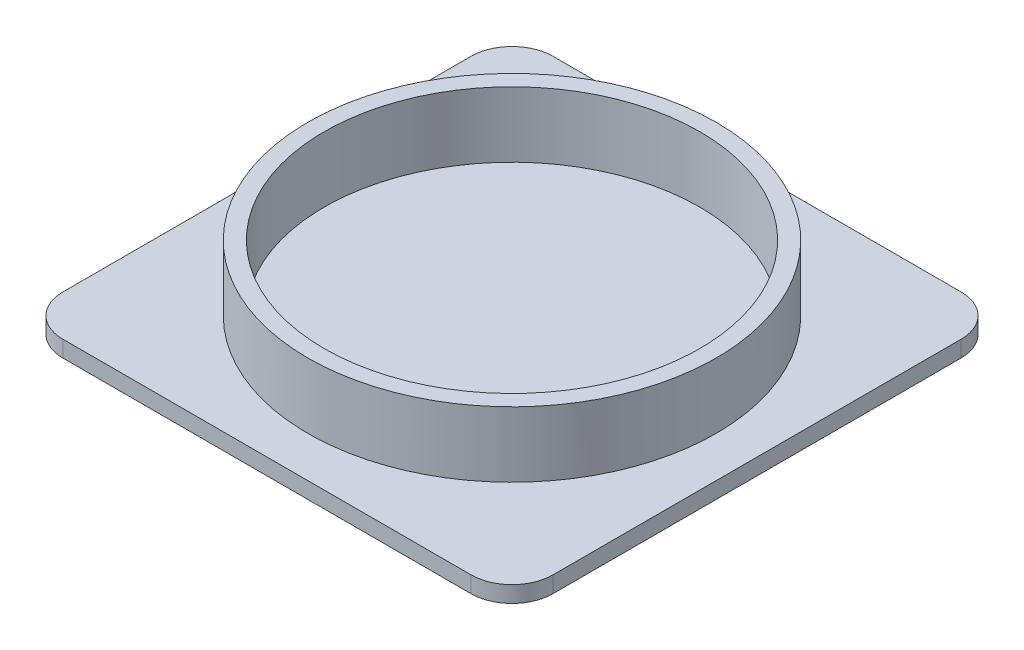
from build123d import *

# Parameters (mm, degrees)
SKETCH1_R           = 31.75
SKETCH1_R_2         = 29.21
BOSS_EXTRUDE1_DEPTH = 12.7
SKETCH2_W           = 76.2
SKETCH2_H           = 76.2
BOSS_EXTRUDE2_DEPTH = 2.54
FILLET1_R           = 6.35


with BuildPart() as part:
    # Sketch1 → Boss-Extrude1 (new body)
    with BuildSketch(Plane(origin=(0, 0, 0), x_dir=(1, 0, 0), z_dir=(0, 1, 0))):
        Circle(SKETCH1_R)
        Circle(SKETCH1_R_2, mode=Mode.SUBTRACT)
    extrude(amount=BOSS_EXTRUDE1_DEPTH)

    # Sketch2 → Boss-Extrude2 (add)
    with BuildSketch(Plane(origin=(0, 0, 0), x_dir=(1, 0, 0), z_dir=(0, 1, 0))):
        Rectangle(SKETCH2_W, SKETCH2_H)
    extrude(amount=BOSS_EXTRUDE2_DEPTH)

    # Fillet1
    fillet1_edges = [part.edges().sort_by_distance(p)[0] for p in [
        (-38.1, 1.27, -38.1),
        (-38.1, 1.27, 38.1),
        (38.1, 1.27, -38.1),
        (38.1, 1.27, 38.1),
    ]]
    fillet(fillet1_edges, radius=FILLET1_R)


solid = part.part
